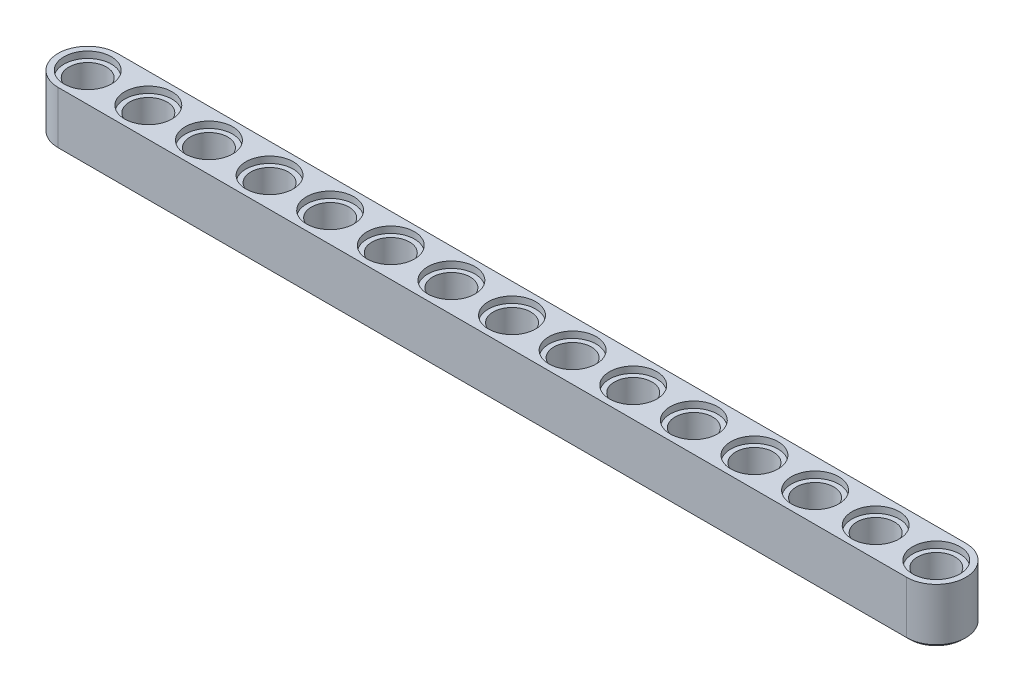
from build123d import *

# Parameters (mm, degrees)
BOSS_EXTRUDE1_DEPTH        = 7.3
SKETCH2_R                  = 2.475
CUT_EXTRUDE1_DEPTH         = 117.195137592
SKETCH3_R                  = 3.125
CUT_EXTRUDE2_DEPTH         = 0.85
LPATTERN1_COUNT            = 15
LPATTERN1_PITCH            = 8
LPATTERN1_COPY_1_SKETCH_R  = 3.125
LPATTERN1_COPY_1_DEPTH     = 0.85
LPATTERN1_COPY_2_SKETCH_R  = 3.125
LPATTERN1_COPY_2_DEPTH     = 0.85
LPATTERN1_COPY_3_SKETCH_R  = 3.125
LPATTERN1_COPY_3_DEPTH     = 0.85
LPATTERN1_COPY_4_SKETCH_R  = 3.125
LPATTERN1_COPY_4_DEPTH     = 0.85
LPATTERN1_COPY_5_SKETCH_R  = 3.125
LPATTERN1_COPY_5_DEPTH     = 0.85
LPATTERN1_COPY_6_SKETCH_R  = 3.125
LPATTERN1_COPY_6_DEPTH     = 0.85
LPATTERN1_COPY_7_SKETCH_R  = 3.125
LPATTERN1_COPY_7_DEPTH     = 0.85
LPATTERN1_COPY_8_SKETCH_R  = 3.125
LPATTERN1_COPY_8_DEPTH     = 0.85
LPATTERN1_COPY_9_SKETCH_R  = 3.125
LPATTERN1_COPY_9_DEPTH     = 0.85
LPATTERN1_COPY_10_SKETCH_R = 3.125
LPATTERN1_COPY_10_DEPTH    = 0.85
LPATTERN1_COPY_11_SKETCH_R = 3.125
LPATTERN1_COPY_11_DEPTH    = 0.85
LPATTERN1_COPY_12_SKETCH_R = 3.125
LPATTERN1_COPY_12_DEPTH    = 0.85
LPATTERN1_COPY_13_SKETCH_R = 3.125
LPATTERN1_COPY_13_DEPTH    = 0.85
LPATTERN1_COPY_14_SKETCH_R = 3.125
LPATTERN1_COPY_14_DEPTH    = 0.85
CHAMFER1_SIZE              = 0.4


with BuildPart() as part:
    # Sketch1 → Boss-Extrude1 (new body)
    with BuildSketch(Plane(origin=(0, 0, 0), x_dir=(1, 0, 0), z_dir=(0, 1, 0))):
        with BuildLine():
            Line((0, 3.9), (112, 3.9))
            ThreePointArc((112, 3.9), (115.9, 0), (112, -3.9))
            Line((112, -3.9), (0, -3.9))
            ThreePointArc((0, -3.9), (-3.9, 0), (0, 3.9))
        make_face()
    extrude(amount=BOSS_EXTRUDE1_DEPTH)

    # Sketch2 → Cut-Extrude1 (cut, through all)
    with BuildSketch(Plane(origin=(0, 7.3, 0), x_dir=(1, 0, 0), z_dir=(0, 1, 0))):
        with Locations(Location((0, 0, 0), (0, 0, 270))):
            Circle(SKETCH2_R)
    cut_extrude1 = extrude(amount=-CUT_EXTRUDE1_DEPTH, mode=Mode.SUBTRACT)

    # Sketch3 → Cut-Extrude2 (cut)
    with BuildSketch(Plane(origin=(0, 7.3, 0), x_dir=(1, 0, 0), z_dir=(0, 1, 0))):
        with Locations(Location((0, 0, 0), (0, 0, 270))):
            Circle(SKETCH3_R)
    cut_extrude2 = extrude(amount=-CUT_EXTRUDE2_DEPTH, mode=Mode.SUBTRACT)

    # Mirror1: Cut-Extrude2 across plane
    add(cut_extrude2.mirror(Plane.ZX.offset(3.65)), mode=Mode.SUBTRACT)

    # LPattern1: Cut-Extrude1, Cut-Extrude2 ×15
    with Locations(*[(i * LPATTERN1_PITCH, 0, 0) for i in range(1, LPATTERN1_COUNT)]):
        add(cut_extrude1, mode=Mode.SUBTRACT)
        add(cut_extrude2, mode=Mode.SUBTRACT)

    # LPattern1 copy 1 sketch → LPattern1 copy 1 (cut)
    with BuildSketch(Plane(origin=(8, 0, 0), x_dir=(1, 0, 0), z_dir=(0, -1, 0))):
        Circle(LPATTERN1_COPY_1_SKETCH_R)
    extrude(amount=-LPATTERN1_COPY_1_DEPTH, mode=Mode.SUBTRACT)

    # LPattern1 copy 2 sketch → LPattern1 copy 2 (cut)
    with BuildSketch(Plane(origin=(16, 0, 0), x_dir=(1, 0, 0), z_dir=(0, -1, 0))):
        Circle(LPATTERN1_COPY_2_SKETCH_R)
    extrude(amount=-LPATTERN1_COPY_2_DEPTH, mode=Mode.SUBTRACT)

    # LPattern1 copy 3 sketch → LPattern1 copy 3 (cut)
    with BuildSketch(Plane(origin=(24, 0, 0), x_dir=(1, 0, 0), z_dir=(0, -1, 0))):
        Circle(LPATTERN1_COPY_3_SKETCH_R)
    extrude(amount=-LPATTERN1_COPY_3_DEPTH, mode=Mode.SUBTRACT)

    # LPattern1 copy 4 sketch → LPattern1 copy 4 (cut)
    with BuildSketch(Plane(origin=(32, 0, 0), x_dir=(1, 0, 0), z_dir=(0, -1, 0))):
        Circle(LPATTERN1_COPY_4_SKETCH_R)
    extrude(amount=-LPATTERN1_COPY_4_DEPTH, mode=Mode.SUBTRACT)

    # LPattern1 copy 5 sketch → LPattern1 copy 5 (cut)
    with BuildSketch(Plane(origin=(40, 0, 0), x_dir=(1, 0, 0), z_dir=(0, -1, 0))):
        Circle(LPATTERN1_COPY_5_SKETCH_R)
    extrude(amount=-LPATTERN1_COPY_5_DEPTH, mode=Mode.SUBTRACT)

    # LPattern1 copy 6 sketch → LPattern1 copy 6 (cut)
    with BuildSketch(Plane(origin=(48, 0, 0), x_dir=(1, 0, 0), z_dir=(0, -1, 0))):
        Circle(LPATTERN1_COPY_6_SKETCH_R)
    extrude(amount=-LPATTERN1_COPY_6_DEPTH, mode=Mode.SUBTRACT)

    # LPattern1 copy 7 sketch → LPattern1 copy 7 (cut)
    with BuildSketch(Plane(origin=(56, 0, 0), x_dir=(1, 0, 0), z_dir=(0, -1, 0))):
        Circle(LPATTERN1_COPY_7_SKETCH_R)
    extrude(amount=-LPATTERN1_COPY_7_DEPTH, mode=Mode.SUBTRACT)

    # LPattern1 copy 8 sketch → LPattern1 copy 8 (cut)
    with BuildSketch(Plane(origin=(64, 0, 0), x_dir=(1, 0, 0), z_dir=(0, -1, 0))):
        Circle(LPATTERN1_COPY_8_SKETCH_R)
    extrude(amount=-LPATTERN1_COPY_8_DEPTH, mode=Mode.SUBTRACT)

    # LPattern1 copy 9 sketch → LPattern1 copy 9 (cut)
    with BuildSketch(Plane(origin=(72, 0, 0), x_dir=(1, 0, 0), z_dir=(0, -1, 0))):
        Circle(LPATTERN1_COPY_9_SKETCH_R)
    extrude(amount=-LPATTERN1_COPY_9_DEPTH, mode=Mode.SUBTRACT)

    # LPattern1 copy 10 sketch → LPattern1 copy 10 (cut)
    with BuildSketch(Plane(origin=(80, 0, 0), x_dir=(1, 0, 0), z_dir=(0, -1, 0))):
        Circle(LPATTERN1_COPY_10_SKETCH_R)
    extrude(amount=-LPATTERN1_COPY_10_DEPTH, mode=Mode.SUBTRACT)

    # LPattern1 copy 11 sketch → LPattern1 copy 11 (cut)
    with BuildSketch(Plane(origin=(88, 0, 0), x_dir=(1, 0, 0), z_dir=(0, -1, 0))):
        Circle(LPATTERN1_COPY_11_SKETCH_R)
    extrude(amount=-LPATTERN1_COPY_11_DEPTH, mode=Mode.SUBTRACT)

    # LPattern1 copy 12 sketch → LPattern1 copy 12 (cut)
    with BuildSketch(Plane(origin=(96, 0, 0), x_dir=(1, 0, 0), z_dir=(0, -1, 0))):
        Circle(LPATTERN1_COPY_12_SKETCH_R)
    extrude(amount=-LPATTERN1_COPY_12_DEPTH, mode=Mode.SUBTRACT)

    # LPattern1 copy 13 sketch → LPattern1 copy 13 (cut)
    with BuildSketch(Plane(origin=(104, 0, 0), x_dir=(1, 0, 0), z_dir=(0, -1, 0))):
        Circle(LPATTERN1_COPY_13_SKETCH_R)
    extrude(amount=-LPATTERN1_COPY_13_DEPTH, mode=Mode.SUBTRACT)

    # LPattern1 copy 14 sketch → LPattern1 copy 14 (cut)
    with BuildSketch(Plane(origin=(112, 0, 0), x_dir=(1, 0, 0), z_dir=(0, -1, 0))):
        Circle(LPATTERN1_COPY_14_SKETCH_R)
    extrude(amount=-LPATTERN1_COPY_14_DEPTH, mode=Mode.SUBTRACT)

    # Chamfer1
    # the kernel refuses this chamfer: 0.4 mm, written as the material it takes off along each edge
    with BuildSketch(Plane(origin=(8, 0, 0), x_dir=(1, 0, 0), z_dir=(0, 0, -1))) as chamfer1_piece_1:
        Polygon((3.125 + CHAMFER1_SIZE, 0), (3.125, -CHAMFER1_SIZE), (3.125, 0), align=None)
    revolve(axis=Axis((8, 0, 0), (0, -1, 0)), mode=Mode.SUBTRACT)
    with BuildSketch(Plane(origin=(16, 0, 0), x_dir=(1, 0, 0), z_dir=(0, 0, -1))) as chamfer1_piece_2:
        Polygon((3.125 + CHAMFER1_SIZE, 0), (3.125, -CHAMFER1_SIZE), (3.125, 0), align=None)
    revolve(axis=Axis((16, 0, 0), (0, -1, 0)), mode=Mode.SUBTRACT)
    with BuildSketch(Plane(origin=(24, 0, 0), x_dir=(1, 0, 0), z_dir=(0, 0, -1))) as chamfer1_piece_3:
        Polygon((3.125 + CHAMFER1_SIZE, 0), (3.125, -CHAMFER1_SIZE), (3.125, 0), align=None)
    revolve(axis=Axis((24, 0, 0), (0, -1, 0)), mode=Mode.SUBTRACT)
    with BuildSketch(Plane(origin=(32, 0, 0), x_dir=(1, 0, 0), z_dir=(0, 0, -1))) as chamfer1_piece_4:
        Polygon((3.125 + CHAMFER1_SIZE, 0), (3.125, -CHAMFER1_SIZE), (3.125, 0), align=None)
    revolve(axis=Axis((32, 0, 0), (0, -1, 0)), mode=Mode.SUBTRACT)
    with BuildSketch(Plane(origin=(40, 0, 0), x_dir=(1, 0, 0), z_dir=(0, 0, -1))) as chamfer1_piece_5:
        Polygon((3.125 + CHAMFER1_SIZE, 0), (3.125, -CHAMFER1_SIZE), (3.125, 0), align=None)
    revolve(axis=Axis((40, 0, 0), (0, -1, 0)), mode=Mode.SUBTRACT)
    with BuildSketch(Plane(origin=(48, 0, 0), x_dir=(1, 0, 0), z_dir=(0, 0, -1))) as chamfer1_piece_6:
        Polygon((3.125 + CHAMFER1_SIZE, 0), (3.125, -CHAMFER1_SIZE), (3.125, 0), align=None)
    revolve(axis=Axis((48, 0, 0), (0, -1, 0)), mode=Mode.SUBTRACT)
    with BuildSketch(Plane(origin=(56, 0, 0), x_dir=(1, 0, 0), z_dir=(0, 0, -1))) as chamfer1_piece_7:
        Polygon((3.125 + CHAMFER1_SIZE, 0), (3.125, -CHAMFER1_SIZE), (3.125, 0), align=None)
    revolve(axis=Axis((56, 0, 0), (0, -1, 0)), mode=Mode.SUBTRACT)
    with BuildSketch(Plane(origin=(64, 0, 0), x_dir=(1, 0, 0), z_dir=(0, 0, -1))) as chamfer1_piece_8:
        Polygon((3.125 + CHAMFER1_SIZE, 0), (3.125, -CHAMFER1_SIZE), (3.125, 0), align=None)
    revolve(axis=Axis((64, 0, 0), (0, -1, 0)), mode=Mode.SUBTRACT)
    with BuildSketch(Plane(origin=(72, 0, 0), x_dir=(1, 0, 0), z_dir=(0, 0, -1))) as chamfer1_piece_9:
        Polygon((3.125 + CHAMFER1_SIZE, 0), (3.125, -CHAMFER1_SIZE), (3.125, 0), align=None)
    revolve(axis=Axis((72, 0, 0), (0, -1, 0)), mode=Mode.SUBTRACT)
    with BuildSketch(Plane(origin=(80, 0, 0), x_dir=(1, 0, 0), z_dir=(0, 0, -1))) as chamfer1_piece_10:
        Polygon((3.125 + CHAMFER1_SIZE, 0), (3.125, -CHAMFER1_SIZE), (3.125, 0), align=None)
    revolve(axis=Axis((80, 0, 0), (0, -1, 0)), mode=Mode.SUBTRACT)
    with BuildSketch(Plane(origin=(88, 0, 0), x_dir=(1, 0, 0), z_dir=(0, 0, -1))) as chamfer1_piece_11:
        Polygon((3.125 + CHAMFER1_SIZE, 0), (3.125, -CHAMFER1_SIZE), (3.125, 0), align=None)
    revolve(axis=Axis((88, 0, 0), (0, -1, 0)), mode=Mode.SUBTRACT)
    with BuildSketch(Plane(origin=(96, 0, 0), x_dir=(1, 0, 0), z_dir=(0, 0, -1))) as chamfer1_piece_12:
        Polygon((3.125 + CHAMFER1_SIZE, 0), (3.125, -CHAMFER1_SIZE), (3.125, 0), align=None)
    revolve(axis=Axis((96, 0, 0), (0, -1, 0)), mode=Mode.SUBTRACT)
    with BuildSketch(Plane(origin=(104, 0, 0), x_dir=(1, 0, 0), z_dir=(0, 0, -1))) as chamfer1_piece_13:
        Polygon((3.125 + CHAMFER1_SIZE, 0), (3.125, -CHAMFER1_SIZE), (3.125, 0), align=None)
    revolve(axis=Axis((104, 0, 0), (0, -1, 0)), mode=Mode.SUBTRACT)
    with BuildSketch(Plane(origin=(112, 0, 0), x_dir=(1, 0, 0), z_dir=(0, 0, -1))) as chamfer1_piece_14:
        Polygon((3.125 + CHAMFER1_SIZE, 0), (3.125, -CHAMFER1_SIZE), (3.125, 0), align=None)
    revolve(axis=Axis((112, 0, 0), (0, -1, 0)), mode=Mode.SUBTRACT)
    with BuildSketch(Plane(origin=(0, 0, 0), x_dir=(0, 0, 1), z_dir=(-1, 0, 0))) as chamfer1_piece_15:
        Polygon((3.125 + CHAMFER1_SIZE, 0), (3.125, CHAMFER1_SIZE), (3.125, 0), align=None)
    revolve(axis=Axis((0, 0, 0), (0, 1, 0)), mode=Mode.SUBTRACT)
    with BuildSketch(Plane(origin=(0, 0, -3.9), x_dir=(0, -0.027495876610586386, 0.9996219169112968), z_dir=(1, 0, 0))) as chamfer1_piece_16:
        Polygon((CHAMFER1_SIZE * 0.999621916911, -CHAMFER1_SIZE * 0.0274958766106), (-CHAMFER1_SIZE * 0.0274958766106, -CHAMFER1_SIZE * 0.999621916911), (0, 0), align=None)
    extrude(amount=112, mode=Mode.SUBTRACT)
    with BuildSketch(Plane(origin=(112, 0, 0), x_dir=(0, 0, -1), z_dir=(-1, 0, 0))) as chamfer1_piece_17:
        Polygon((3.9, -CHAMFER1_SIZE), (3.9 - CHAMFER1_SIZE, 0), (3.9, 0), align=None)
    revolve(axis=Axis((112, 0, 0), (0, -1, 0)), revolution_arc=180, mode=Mode.SUBTRACT)
    with BuildSketch(Plane(origin=(112, 0, 3.9), x_dir=(0, 0.9996219169112968, 0.027495876610586275), z_dir=(-1, 0, 0))) as chamfer1_piece_18:
        Polygon((CHAMFER1_SIZE * 0.999621916911, CHAMFER1_SIZE * 0.0274958766106), (-CHAMFER1_SIZE * 0.0274958766106, CHAMFER1_SIZE * 0.999621916911), (0, 0), align=None)
    extrude(amount=112, mode=Mode.SUBTRACT)
    with BuildSketch(Plane(origin=(0, 0, 0), x_dir=(0, 0, 1), z_dir=(1, 0, 0))) as chamfer1_piece_19:
        Polygon((3.9, -CHAMFER1_SIZE), (3.9 - CHAMFER1_SIZE, 0), (3.9, 0), align=None)
    revolve(axis=Axis((0, 0, 0), (0, -1, 0)), revolution_arc=180, mode=Mode.SUBTRACT)


solid = part.part
